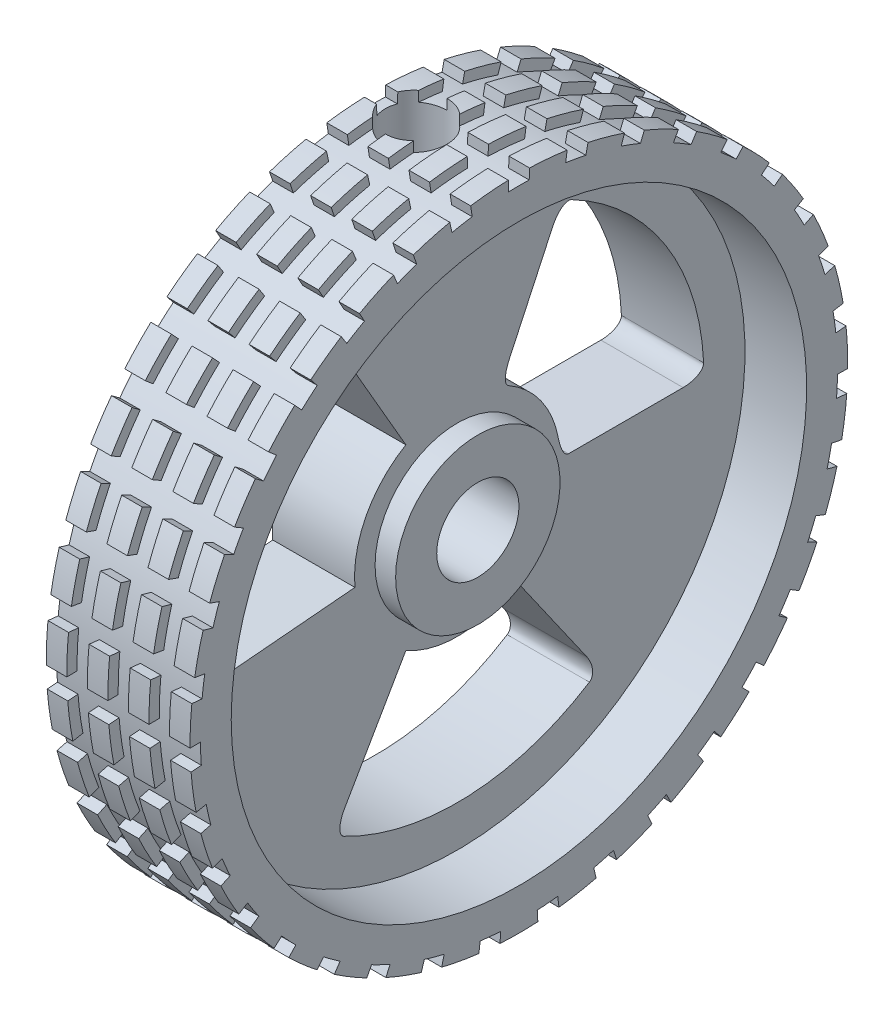
from build123d import *
from build123d.topology import SkipClean

# Parameters (mm, degrees)
SKETCH4_W          = 1
SKETCH4_H          = 0.5
CUT_EXTRUDE4_DEPTH = 24.685438747
CIRPATTERN1_COUNT  = 35
LPATTERN1_COUNT    = 3
LPATTERN1_PITCH    = 2
CUT_EXTRUDE5_DEPTH = 23.978250604
CIRPATTERN2_DEPTH  = 4


with BuildPart() as part:
    # Sketch1 → Revolve1 (revolve)
    with BuildSketch(Plane.XY, mode=Mode.PRIVATE) as revolve1_sk:
        Polygon((0, 2), (0, 16), (7, 16), (7, 14), (4, 14), (4, 4), (5, 4), (5, 2), align=None)
    revolve(revolve1_sk.sketch.rotate(Axis((0, 0, 0), (1, 0, 0)), 90), axis=Axis((0, 0, 0), (1, 0, 0)))

    # Sketch2 → Cut-Revolve1 (revolve, cut)
    with BuildSketch(Plane.XY, mode=Mode.PRIVATE) as cut_revolve1_sk:
        Polygon((2, 0), (2, 16), (3.5, 16), (3.5, 11.5), (2.9, 11.5), (2.9, 0), align=None)
    revolve(cut_revolve1_sk.sketch.rotate(Axis((2, 0, 0), (0, 1, 0)), 90), axis=Axis((2, 0, 0), (0, 1, 0)), mode=Mode.SUBTRACT)

    # Sketch4 → Cut-Revolve2 (revolve, cut)
    with BuildSketch(Plane(origin=(0, 0, 0), x_dir=(1, 0, 0), z_dir=(0, 1, 0)), mode=Mode.PRIVATE) as cut_revolve2_sk:
        with Locations((5.5, 15.75)):
            Rectangle(SKETCH4_W, SKETCH4_H)
    cut_revolve2 = revolve(cut_revolve2_sk.sketch.rotate(Axis((0, 0, 0), (-1, 0, 0)), 180), axis=Axis((0, 0, 0), (-1, 0, 0)), mode=Mode.SUBTRACT)

    # Sketch5 → Cut-Extrude4 (cut, through all)
    with SkipClean():  # the faces are left unmerged after this step: merging them gives an invalid solid
        with BuildSketch(Plane(origin=(7, 0, 0), x_dir=(0, 0, -1), z_dir=(1, 0, 0))):
            with BuildLine():
                Line((-0.5, 15.491933385), (-0.516129032, 15.991673171))
                ThreePointArc((-0.516129032, 15.991673171), (0, 16), (0.516129032, 15.991673171))
                Line((0.516129032, 15.991673171), (0.5, 15.491933385))
                ThreePointArc((0.5, 15.491933385), (0, 15.5), (-0.5, 15.491933385))
            make_face()
        cut_extrude4 = extrude(amount=-CUT_EXTRUDE4_DEPTH, mode=Mode.SUBTRACT)

    # CirPattern1: Cut-Extrude4 ×35 about axis
    with SkipClean():  # the faces are left unmerged after this step: merging them gives an invalid solid
        cirpattern1_axis = Axis((0, 0, 0), (1, 0, 0))
        for i in range(1, CIRPATTERN1_COUNT):
            add(cut_extrude4.rotate(cirpattern1_axis, i * 360 / CIRPATTERN1_COUNT), mode=Mode.SUBTRACT)

    # LPattern1: Cut-Revolve2 ×3
    with Locations(*[(-i * LPATTERN1_PITCH, 0, 0) for i in range(1, LPATTERN1_COUNT)]):
        add(cut_revolve2, mode=Mode.SUBTRACT)

    # Sketch7 → Cut-Extrude5 (cut, through all)
    with BuildSketch(Plane(origin=(4, 0, 0), x_dir=(0, 0, -1), z_dir=(1, 0, 0))):
        with BuildLine():
            Line((2.113091309, 4.531538935), (5.071419141, 10.875693444))
            ThreePointArc((5.071419141, 10.875693444), (10.12069735, 6.4475953), (12, 0))
            Line((12, 0), (5, 0))
            ThreePointArc((5, 0), (4.216957229, 2.686498042), (2.113091309, 4.531538935))
        make_face()
    extrude(amount=-CUT_EXTRUDE5_DEPTH, mode=Mode.SUBTRACT)

    # Fillet2
    # a fillet whose section is not a circle: 1, 0.5 mm, written as the material it adds along each edge
    with BuildSketch(Plane(origin=(4, 0, -12), x_dir=(0, 0, 1), z_dir=(-1, 0, 0))) as fillet2_piece_1:
        with BuildLine():
            Bezier((1.011369512, 0), (-0.012415937, 0), (0.012403104, 0.545454545), weights=[1, 0.69084928, 1])
            ThreePointArc((0.012403104, 0.545454545), (0.003101177, 0.272797772), (0, 0))
            Line((0, 0), (1.011369512, 0))
        make_face()
    extrude(amount=4)
    with BuildSketch(Plane(origin=(4, 10.875693444, -5.071419141), x_dir=(0, -0.9063077870366494, 0.42261826174070066), z_dir=(-1, 0, 0))) as fillet2_piece_2:
        with BuildLine():
            Bezier((1.011369512, 0), (-0.012415937, 0), (0.012403104, -0.545454545), weights=[1, 0.69084928, 1])
            ThreePointArc((0.012403104, -0.545454545), (0.003101177, -0.272797772), (0, 0))
            Line((0, 0), (1.011369512, 0))
        make_face()
    extrude(amount=4)

    # Fillet3
    # a fillet whose section is not a circle: 1, 0.5 mm, written as the material it adds along each edge
    with BuildSketch(Plane(origin=(4, 0, -5), x_dir=(0, 0.9958243233712547, 0.09129028963796051), z_dir=(-1, 0, 0))) as fillet3_piece_1:
        with BuildLine():
            Bezier((0.912902896, 0), (-0.007737016, 0.084397903), (-0.037276282, 0.406621872), weights=[1, 0.768706115, 1])
            Line((-0.037276282, 0.406621872), (0, 0))
            ThreePointArc((0, 0), (0.456451448, 0.020878383), (0.912902896, 0))
        make_face()
    extrude(amount=4)
    with BuildSketch(Plane(origin=(4, 4.531538935, -2.113091309), x_dir=(0, 0.9063077870366495, -0.4226182617407006), z_dir=(-1, 0, 0))) as fillet3_piece_2:
        with BuildLine():
            Bezier((0.979130372, 0), (0.01745206, 0), (-0.017391357, 0.416666667), weights=[1, 0.735980072, 1])
            ThreePointArc((-0.017391357, 0.416666667), (-0.004349731, 0.20851473), (0, 0))
            Line((0, 0), (0.979130372, 0))
        make_face()
    extrude(amount=4)

    # CirPattern2: read off the stored shape, not the designer's step
    # CirPattern2 outline → CirPattern2 (cut)
    with BuildSketch(Plane.YZ):
        with BuildLine():
            add(Edge.make_bspline(
                [(-10.654290715, 5.521420955), (-10.403057362, 6.006207969), (-9.516433155, 5.494315244)],
                knots=[0, 0, 0, 1, 1, 1], degree=2, weights=[1, 0.69084928, 1]))
            ThreePointArc((-10.654290715, 5.521420955), (-11.988578659, -0.523432648), (-10.132524378, -6.428992902))
            add(Edge.make_bspline(
                [(-9.001359128, -6.302819516), (-9.839995072, -6.890038725), (-10.132524378, -6.428992902)],
                knots=[0, 0, 0, 1, 1, 1], degree=2, weights=[1, 0.69084928, 1]))
            Line((-9.001359128, -6.302819516), (-4.095760221, -2.867882182))
            ThreePointArc((-4.095760221, -2.867882182), (-4.995241108, -0.218096937), (-4.330127019, 2.5))
            Line((-4.330127019, 2.5), (-9.516433155, 5.494315244))
        make_face()
        with BuildLine():
            add(Edge.make_bspline(
                [(10.108836169, 6.466175941), (10.403057362, 6.006207969), (9.516433155, 5.494315244)],
                knots=[0, 0, 0, 1, 1, 1], degree=2, weights=[1, 0.69084928, 1]))
            ThreePointArc((10.108836169, 6.466175941), (5.540983359, 10.644129998), (-0.501408985, 11.989519967))
            add(Edge.make_bspline(
                [(-0.957722252, 10.946815431), (-1.046951033, 11.966705068), (-0.501408985, 11.989519967)],
                knots=[0, 0, 0, 1, 1, 1], degree=2, weights=[1, 0.69084928, 1]))
            Line((-0.957722252, 10.946815431), (-0.435778714, 4.98097349))
            ThreePointArc((-0.435778714, 4.98097349), (2.308743066, 4.435054166), (4.330127019, 2.5))
            Line((4.330127019, 2.5), (9.516433155, 5.494315244))
        make_face()
    extrude(amount=CIRPATTERN2_DEPTH, mode=Mode.SUBTRACT)


solid = part.part
